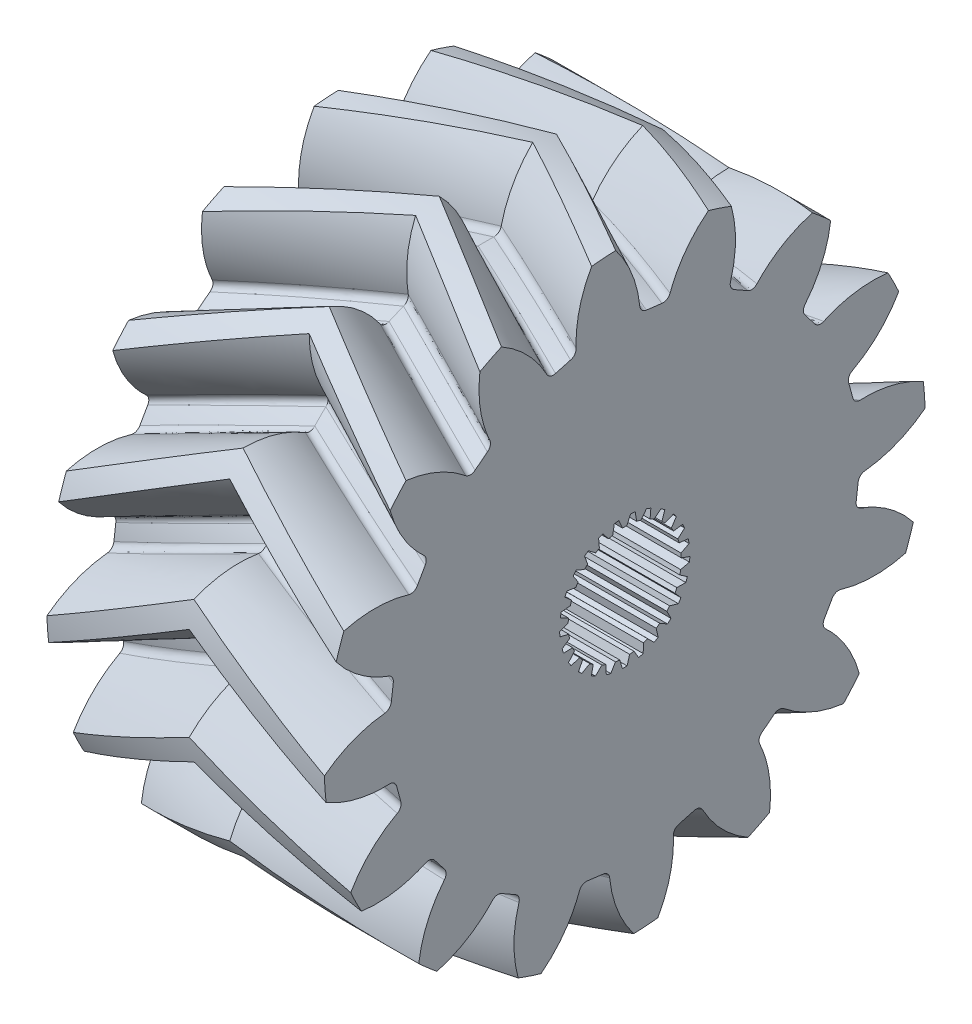
from build123d import *

# Parameters (mm, degrees)
BASPROSKE_W            = 6.5
BASPROSKE_H            = 14.076705922
TOOTHCUTRH_PITCH       = 153.193921513
TOOTHCUTRH_HEIGHT      = 6.5
TOOTHCUTRH_RADIUS      = 14.076705922
TOOTHCUTRH_START_ANGLE = -90
TEETHCUTSRH_COUNT      = 16
TEETHCUTSRH_ANGLE      = 337.5
BORSKE_R               = 0.5
BORE_DEPTH             = 62.5000025
SKETCH3_R              = 2.65
CUT_EXTRUDE2_DEPTH     = 24.776192034


with BuildPart() as part:
    # BasProSke → Base-Revolve (revolve)
    with BuildSketch(Plane(origin=(0, 0, 0), x_dir=(1, 0, 0), z_dir=(0, 1, 0)), mode=Mode.PRIVATE) as base_revolve_sk:
        with Locations((3.25, 7.038352961)):
            Rectangle(BASPROSKE_W, BASPROSKE_H)
    revolve(base_revolve_sk.sketch.rotate(Axis((-10, 0, 0), (1, 0, 0)), 180), axis=Axis((-10, 0, 0), (1, 0, 0)))

    # ToothCutRH: sweep along a helix
    with BuildLine() as toothcutrh_path:
        add(Helix(TOOTHCUTRH_PITCH, TOOTHCUTRH_HEIGHT, TOOTHCUTRH_RADIUS, center=(0, 0, 0), direction=(1, 0, 0), mode=Mode.PRIVATE).rotate(Axis((0, 0, 0), (1, 0, 0)), TOOTHCUTRH_START_ANGLE))
    # TooCutSkeRH → ToothCutRH (sweep, cut)
    with BuildSketch(Plane(origin=(0, 0, 0), x_dir=(0, 0, -1), z_dir=(1, 0, 0))):
        with BuildLine():
            ThreePointArc((0.366180331, 10.976849856), (0, 10.982955922), (-0.366180331, 10.976849856))
            ThreePointArc((-0.366180331, 10.976849856), (-0.587868862, 11.048148386), (-0.713651287, 11.244128148))
            ThreePointArc((-0.713651287, 11.244128148), (-1.400098607, 12.910816951), (-2.588521889, 14.266070283))
            ThreePointArc((-2.588521889, 14.266070283), (0, 14.4990071), (2.588521889, 14.266070283))
            ThreePointArc((2.588521889, 14.266070283), (1.400098607, 12.910816951), (0.713651287, 11.244128148))
            ThreePointArc((0.713651287, 11.244128148), (0.587868862, 11.048148386), (0.366180331, 10.976849856))
        make_face()
    toothcutrh = sweep(path=toothcutrh_path.line, is_frenet=True, mode=Mode.SUBTRACT)

    # TeethCutsRH: ToothCutRH ×16 about axis
    teethcutsrh_axis = Axis((-10, 0, 0), (1, 0, 0))
    for i in range(1, TEETHCUTSRH_COUNT):
        add(toothcutrh.rotate(teethcutsrh_axis, i * TEETHCUTSRH_ANGLE / (TEETHCUTSRH_COUNT - 1)), mode=Mode.SUBTRACT)

    # BorSke → Bore (cut, symmetric)
    with BuildSketch(Plane(origin=(0, 0, 0), x_dir=(0, 0, -1), z_dir=(1, 0, 0))):
        with Locations(Location((0, 0, 0), (0, 0, 180))):
            Circle(BORSKE_R)
    extrude(amount=BORE_DEPTH, both=True, mode=Mode.SUBTRACT)

    # Mirror1: part across plane


with BuildPart() as part_1:
    add(part.part)
    add(part.part.mirror(Plane(origin=(0, 0, 0), x_dir=(0, 0, 1), z_dir=(1, 0, 0))))

    # Sketch3 → Cut-Extrude2 (cut, through all)
    with BuildSketch(Plane(origin=(6.5, 0, 0), x_dir=(0, 0, -1), z_dir=(1, 0, 0))):
        Circle(SKETCH3_R)
        with BuildLine():
            ThreePointArc((-1.738556427, 1.999980388), (-1.557630919, 2.143895035), (-1.364850899, 2.271493347))
            Line((-1.364850899, 2.271493347), (-1.70314903, 2.530174575))
            ThreePointArc((-1.70314903, 2.530174575), (-1.792745019, 2.467501833), (-1.880037023, 2.401657926))
            Line((-1.880037023, 2.401657926), (-1.738556427, 1.999980388))
        make_face()
        with BuildLine():
            ThreePointArc((-1.186561583, 2.369508728), (-0.975530065, 2.463907688), (-0.757074174, 2.539554822))
            Line((-0.757074174, 2.539554822), (-1.020412642, 2.874240429))
            ThreePointArc((-1.020412642, 2.874240429), (-1.122779886, 2.835818282), (-1.223704164, 2.793751621))
            Line((-1.223704164, 2.793751621), (-1.186561583, 2.369508728))
        make_face()
        with BuildLine():
            ThreePointArc((-0.560010711, 2.59015212), (-0.332133069, 2.629103958), (-0.101727694, 2.648046728))
            Line((-0.101727694, 2.648046728), (-0.273559974, 3.037707185))
            ThreePointArc((-0.273559974, 3.037707185), (-0.382266362, 3.025949839), (-0.490481472, 3.010303627))
            Line((-0.490481472, 3.010303627), (-0.560010711, 2.59015212))
        make_face()
        with BuildLine():
            Line((0.273559974, 3.037707185), (0.101727694, 2.648046728))
            ThreePointArc((0.101727694, 2.648046728), (0.332133069, 2.629103958), (0.560010711, 2.59015212))
            Line((0.560010711, 2.59015212), (0.490481472, 3.010303627))
            ThreePointArc((0.490481472, 3.010303627), (0.382266362, 3.025949839), (0.273559974, 3.037707185))
        make_face()
        with BuildLine():
            Line((1.020412642, 2.874240429), (0.757074174, 2.539554822))
            ThreePointArc((0.757074174, 2.539554822), (0.975530065, 2.463907688), (1.186561583, 2.369508728))
            Line((1.186561583, 2.369508728), (1.223704164, 2.793751621))
            ThreePointArc((1.223704164, 2.793751621), (1.122779886, 2.835818282), (1.020412642, 2.874240429))
        make_face()
        with BuildLine():
            Line((1.70314903, 2.530174575), (1.364850899, 2.271493347))
            ThreePointArc((1.364850899, 2.271493347), (1.557630919, 2.143895035), (1.738556427, 1.999980388))
            Line((1.738556427, 1.999980388), (1.880037023, 2.401657926))
            ThreePointArc((1.880037023, 2.401657926), (1.792745019, 2.467501833), (1.70314903, 2.530174575))
        make_face()
        with BuildLine():
            Line((2.278870301, 2.027128548), (1.886869022, 1.86070559))
            ThreePointArc((1.886869022, 1.86070559), (2.041860093, 1.689173573), (2.181311377, 1.504785924))
            Line((2.181311377, 1.504785924), (2.418240241, 1.85865923))
            ThreePointArc((2.418240241, 1.85865923), (2.35006539, 1.944143169), (2.278870301, 2.027128548))
        make_face()
        with BuildLine():
            Line((2.71140177, 1.396710579), (2.290328225, 1.333002859))
            ThreePointArc((2.290328225, 1.333002859), (2.397791689, 1.128315123), (2.48700651, 0.915040227))
            Line((2.48700651, 0.915040227), (2.804496532, 1.19887414))
            ThreePointArc((2.804496532, 1.19887414), (2.75972251, 1.298626839), (2.71140177, 1.396710579))
        make_face()
        with BuildLine():
            Line((2.973565894, 0.678532148), (2.549877683, 0.721542655))
            ThreePointArc((2.549877683, 0.721542655), (2.603061214, 0.496560484), (2.636433878, 0.267799188))
            Line((2.636433878, 0.267799188), (3.014535991, 0.463759378))
            ThreePointArc((3.014535991, 0.463759378), (2.995976115, 0.571513009), (2.973565894, 0.678532148))
        make_face()
        with BuildLine():
            Line((3.048889936, -0.082280954), (2.649208948, 0.064745272))
            ThreePointArc((2.649208948, 0.064745272), (2.64980223, 0.032375052), (2.65, 0))
            ThreePointArc((2.65, 0), (2.642540604, -0.198693626), (2.62020441, -0.39626866))
            Line((2.62020441, -0.39626866), (3.035161067, -0.300495091))
            ThreePointArc((3.035161067, -0.300495091), (3.043981522, -0.191511085), (3.048889936, -0.082280954))
        make_face()
        with BuildLine():
            ThreePointArc((2.86507581, -1.045868348), (2.900722375, -0.942501833), (2.932641011, -0.837924041))
            Line((2.932641011, -0.837924041), (2.582080672, -0.596120294))
            ThreePointArc((2.582080672, -0.596120294), (2.520299768, -0.818895035), (2.439337862, -1.03543749))
            Line((2.439337862, -1.03543749), (2.86507581, -1.045868348))
        make_face()
        with BuildLine():
            ThreePointArc((2.514967304, -1.725525851), (2.575200173, -1.634271725), (2.632123466, -1.540917278))
            Line((2.632123466, -1.540917278), (2.352710771, -1.21952943))
            ThreePointArc((2.352710771, -1.21952943), (2.237469003, -1.419941007), (2.105198744, -1.609545975))
            Line((2.105198744, -1.609545975), (2.514967304, -1.725525851))
        make_face()
        with BuildLine():
            ThreePointArc((2.006834152, -2.296762218), (2.087868673, -2.223354314), (2.166219923, -2.147089016))
            Line((2.166219923, -2.147089016), (1.975511399, -1.766311046))
            ThreePointArc((1.975511399, -1.766311046), (1.814049831, -1.931766863), (1.638782248, -2.082520767))
            Line((1.638782248, -2.082520767), (2.006834152, -2.296762218))
        make_face()
        with BuildLine():
            ThreePointArc((1.37260423, -2.723684568), (1.469348706, -2.672735374), (1.564204816, -2.618351255))
            Line((1.564204816, -2.618351255), (1.474183381, -2.202108844))
            ThreePointArc((1.474183381, -2.202108844), (1.276647236, -2.322212702), (1.069395035, -2.42464312))
            Line((1.069395035, -2.42464312), (1.37260423, -2.723684568))
        make_face()
        with BuildLine():
            ThreePointArc((0.652128536, -2.9794678), (0.758504156, -2.954178641), (0.863904967, -2.925092855))
            Line((0.863904967, -2.925092855), (0.880226999, -2.499540044))
            ThreePointArc((0.880226999, -2.499540044), (0.659028201, -2.566745377), (0.4328138, -2.614416228))
            Line((0.4328138, -2.614416228), (0.652128536, -2.9794678))
        make_face()
        with BuildLine():
            ThreePointArc((0.230962718, -2.63991595), (0, -2.65), (-0.230962718, -2.63991595))
            Line((-0.230962718, -2.63991595), (-0.109322792, -3.048040112))
            ThreePointArc((-0.109322792, -3.048040112), (0, -3.05), (0.109322792, -3.048040112))
            Line((0.109322792, -3.048040112), (0.230962718, -2.63991595))
        make_face()
        with BuildLine():
            ThreePointArc((-0.4328138, -2.614416228), (-0.659028201, -2.566745377), (-0.880226999, -2.499540044))
            Line((-0.880226999, -2.499540044), (-0.863904967, -2.925092855))
            ThreePointArc((-0.863904967, -2.925092855), (-0.758504156, -2.954178641), (-0.652128536, -2.9794678))
            Line((-0.652128536, -2.9794678), (-0.4328138, -2.614416228))
        make_face()
        with BuildLine():
            ThreePointArc((-1.069395035, -2.42464312), (-1.276647236, -2.322212702), (-1.474183381, -2.202108844))
            Line((-1.474183381, -2.202108844), (-1.564204816, -2.618351255))
            ThreePointArc((-1.564204816, -2.618351255), (-1.469348706, -2.672735374), (-1.37260423, -2.723684568))
            Line((-1.37260423, -2.723684568), (-1.069395035, -2.42464312))
        make_face()
        with BuildLine():
            ThreePointArc((-1.638782248, -2.082520767), (-1.814049831, -1.931766863), (-1.975511399, -1.766311046))
            Line((-1.975511399, -1.766311046), (-2.166219923, -2.147089016))
            ThreePointArc((-2.166219923, -2.147089016), (-2.087868673, -2.223354314), (-2.006834152, -2.296762218))
            Line((-2.006834152, -2.296762218), (-1.638782248, -2.082520767))
        make_face()
        with BuildLine():
            ThreePointArc((-2.105198744, -1.609545975), (-2.237469003, -1.419941007), (-2.352710771, -1.21952943))
            Line((-2.352710771, -1.21952943), (-2.632123466, -1.540917278))
            ThreePointArc((-2.632123466, -1.540917278), (-2.575200173, -1.634271725), (-2.514967304, -1.725525851))
            Line((-2.514967304, -1.725525851), (-2.105198744, -1.609545975))
        make_face()
        with BuildLine():
            ThreePointArc((-2.439337862, -1.03543749), (-2.520299768, -0.818895035), (-2.582080672, -0.596120294))
            Line((-2.582080672, -0.596120294), (-2.932641011, -0.837924041))
            ThreePointArc((-2.932641011, -0.837924041), (-2.900722375, -0.942501833), (-2.86507581, -1.045868348))
            Line((-2.86507581, -1.045868348), (-2.439337862, -1.03543749))
        make_face()
        with BuildLine():
            ThreePointArc((-2.62020441, -0.39626866), (-2.64477083, -0.166394877), (-2.649208948, 0.064745272))
            Line((-2.649208948, 0.064745272), (-3.048889936, -0.082280954))
            ThreePointArc((-3.048889936, -0.082280954), (-3.043981522, -0.191511085), (-3.035161067, -0.300495091))
            Line((-3.035161067, -0.300495091), (-2.62020441, -0.39626866))
        make_face()
        with BuildLine():
            ThreePointArc((-2.636433878, 0.267799188), (-2.603061214, 0.496560484), (-2.549877683, 0.721542655))
            Line((-2.549877683, 0.721542655), (-2.973565894, 0.678532148))
            ThreePointArc((-2.973565894, 0.678532148), (-2.995976115, 0.571513009), (-3.014535991, 0.463759378))
            Line((-3.014535991, 0.463759378), (-2.636433878, 0.267799188))
        make_face()
        with BuildLine():
            ThreePointArc((-2.48700651, 0.915040227), (-2.397791689, 1.128315123), (-2.290328225, 1.333002859))
            Line((-2.290328225, 1.333002859), (-2.71140177, 1.396710579))
            ThreePointArc((-2.71140177, 1.396710579), (-2.75972251, 1.298626839), (-2.804496532, 1.19887414))
            Line((-2.804496532, 1.19887414), (-2.48700651, 0.915040227))
        make_face()
        with BuildLine():
            ThreePointArc((-2.181311377, 1.504785924), (-2.041860093, 1.689173573), (-1.886869022, 1.86070559))
            Line((-1.886869022, 1.86070559), (-2.278870301, 2.027128548))
            ThreePointArc((-2.278870301, 2.027128548), (-2.35006539, 1.944143169), (-2.418240241, 1.85865923))
            Line((-2.418240241, 1.85865923), (-2.181311377, 1.504785924))
        make_face()
    extrude(amount=-CUT_EXTRUDE2_DEPTH, mode=Mode.SUBTRACT)


solid = part_1.part
